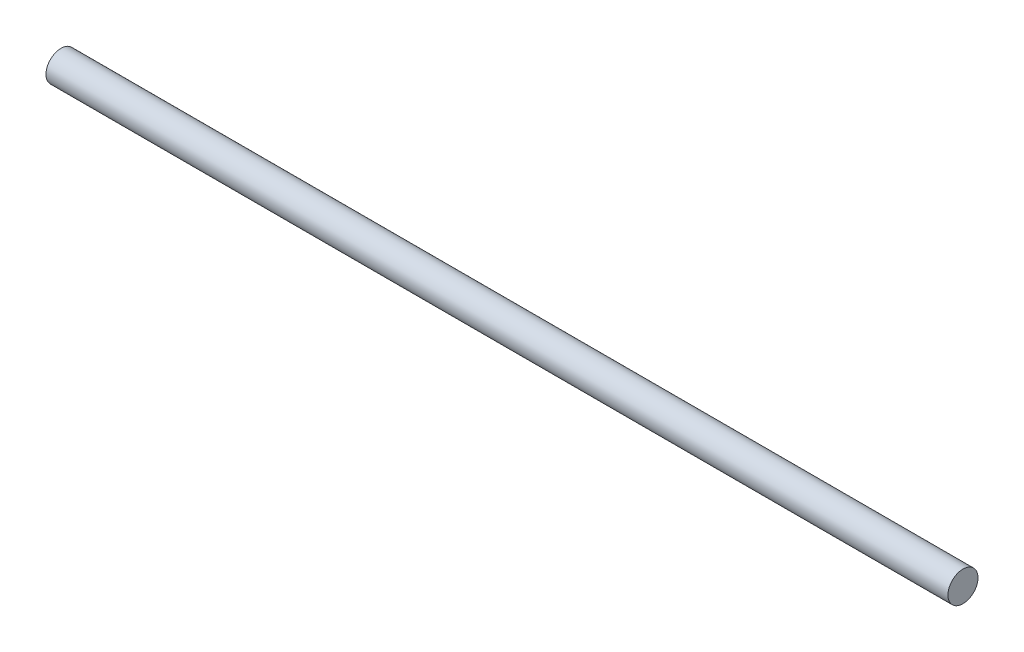
from build123d import *

# Parameters (mm, degrees)
SKETCH1_R           = 2.5
BOSS_EXTRUDE1_DEPTH = 75


with BuildPart() as part:
    # Sketch1 → Boss-Extrude1 (new, symmetric)
    with BuildSketch(Plane(origin=(0, 0, 0), x_dir=(0, 0, -1), z_dir=(1, 0, 0))):
        Circle(SKETCH1_R)
    extrude(amount=BOSS_EXTRUDE1_DEPTH, both=True)


solid = part.part
